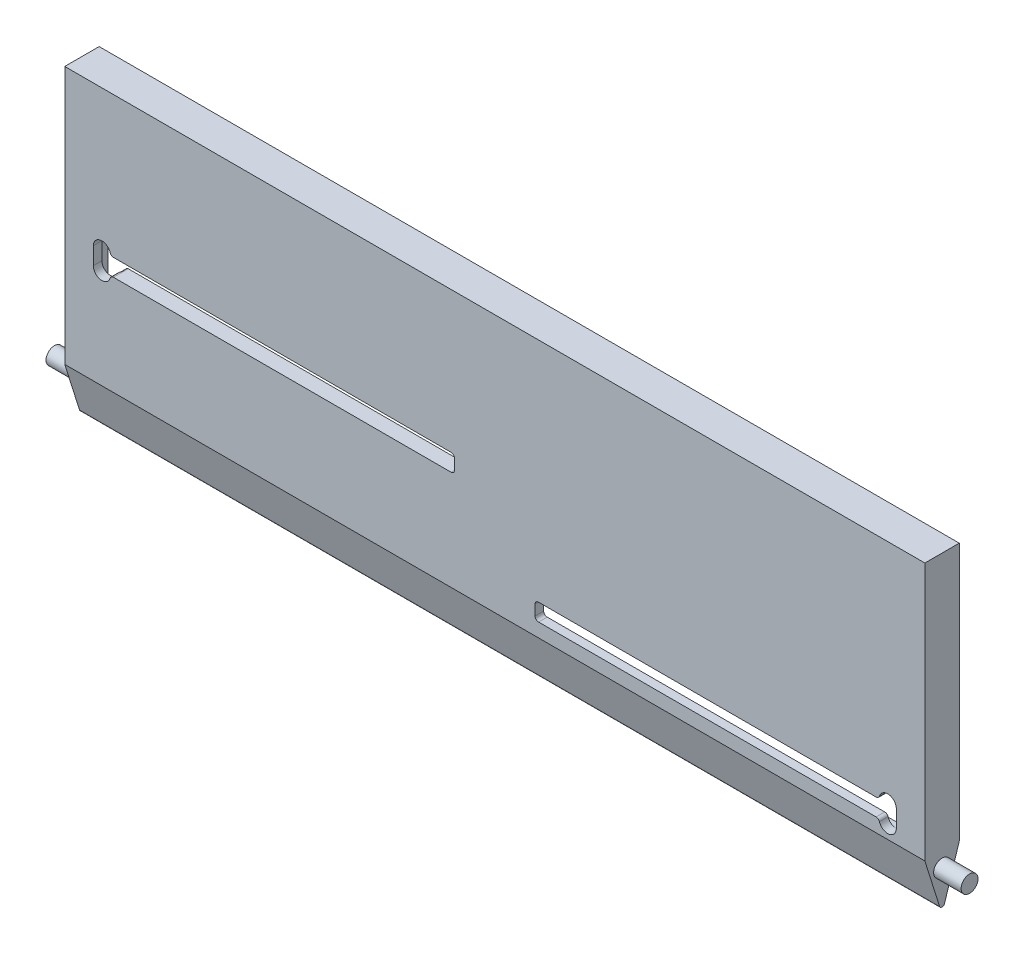
from build123d import *

# Parameters (mm, degrees)
BOSS_EXTRU_1_DEPTH           = 125
ESQUISSE2_R                  = 2.45
BOSS_EXTRU_2_DEPTH           = 8
CONG_1_R                     = 0.75
COQUE1_START                 = -122.5
COQUE1_DEPTH                 = 245
ENL_V_MAT_EXTRU_1_DEPTH      = 162.382066666
ESQUISSE4_R                  = 3.25
ESQUISSE4_R_2                = 1.65
BOSS_EXTRU_3_DEPTH           = 6
R_P_TITION_CIRCULAIRE1_COUNT = 2
BOSS_EXTRU_4_DEPTH           = 1.8


# Read off the part's stored shape, not the designer's step: Coque1
with BuildPart() as part:
    # Esquisse1 → Boss.-Extru.1 (new body)
    with BuildSketch(Plane(origin=(0, 0, 0), x_dir=(0, 0, -1), z_dir=(1, 0, 0))):
        Polygon((5, 15.857974012), (0, 0), (-5, 15.857974012), (-5, 90.857974012), (5, 90.857974012), align=None)
    boss_extru_1 = extrude(amount=BOSS_EXTRU_1_DEPTH)

    # Esquisse2 → Boss.-Extru.2 (add)
    with BuildSketch(Plane.ZY.offset(-125)):
        with Locations((0, 11.639283332)):
            Circle(ESQUISSE2_R)
    boss_extru_2 = extrude(amount=-BOSS_EXTRU_2_DEPTH)

    # Symétrie1: Boss.-Extru.1, Boss.-Extru.2 across plane
    add(boss_extru_1.mirror(Plane(origin=(0, 0, 0), x_dir=(0, 0, 1), z_dir=(1, 0, 0))))
    add(boss_extru_2.mirror(Plane(origin=(0, 0, 0), x_dir=(0, 0, 1), z_dir=(1, 0, 0))))

    # Congé1
    cong_1_edges = [part.edges().sort_by_distance(p)[0] for p in [
        (0, 0, 0),
    ]]
    fillet(cong_1_edges, radius=CONG_1_R)

    # Coque1 outline → Coque1 (cut)
    with BuildSketch(Plane.YZ.offset(COQUE1_START)):
        Polygon((16.242760814, 2.5), (4.156886904, -1.310661406), (15.857974012, -5), (88.357974012, -5), (88.357974012, 2.5), align=None)
    extrude(amount=COQUE1_DEPTH, mode=Mode.SUBTRACT)

    # Esquisse3 → Enlèv. mat.-Extru.1 (cut, through all)
    with BuildSketch(Plane.XY.offset(5)):
        with BuildLine():
            Line((116.7, 19.857974012), (116.7, 24.857974012))
            ThreePointArc((116.7, 24.857974012), (114.560923955, 27.331783604), (111.804212881, 25.572259726))
            ThreePointArc((111.804212881, 25.572259726), (111.443512338, 25.056190286), (110.845898034, 24.857974012))
            Line((110.845898034, 24.857974012), (12.7, 24.857974012))
            ThreePointArc((12.7, 24.857974012), (11.992893219, 24.565080793), (11.7, 23.857974012))
            Line((11.7, 23.857974012), (11.7, 20.857974012))
            ThreePointArc((11.7, 20.857974012), (11.992893219, 20.150867231), (12.7, 19.857974012))
            Line((12.7, 19.857974012), (110.845898034, 19.857974012))
            ThreePointArc((110.845898034, 19.857974012), (111.443512338, 19.659757738), (111.804212881, 19.143688298))
            ThreePointArc((111.804212881, 19.143688298), (114.560923955, 17.38416442), (116.7, 19.857974012))
        make_face()
    enl_v_mat_extru_1 = extrude(amount=-ENL_V_MAT_EXTRU_1_DEPTH, mode=Mode.SUBTRACT)

    # Esquisse4 → Boss.-Extru.3 (add)
    with BuildSketch(Plane(origin=(0, 0, 2.5), x_dir=(-1, 0, 0), z_dir=(0, 0, -1))):
        with Locations(Location((0, 34.857974012, 0), (0, 0, 90))):
            Circle(ESQUISSE4_R)
        with Locations(Location((0, 34.857974012, 0), (0, 0, 90))):
            Circle(ESQUISSE4_R_2, mode=Mode.SUBTRACT)
    extrude(amount=BOSS_EXTRU_3_DEPTH)

    # Répétition circulaire1: Enlèv. mat.-Extru.1 ×2 about axis
    r_p_tition_circulaire1_axis = Axis((0, 34.857974012, 0), (0, 0, 1))
    for i in range(1, R_P_TITION_CIRCULAIRE1_COUNT):
        add(enl_v_mat_extru_1.rotate(r_p_tition_circulaire1_axis, i * 360 / R_P_TITION_CIRCULAIRE1_COUNT), mode=Mode.SUBTRACT)

    # Esquisse5 → Boss.-Extru.4 (add)
    with BuildSketch(Plane(origin=(0, 0, 2.5), x_dir=(-1, 0, 0), z_dir=(0, 0, -1))):
        with BuildLine():
            Line((-13.95, 39.857974012), (-13.95, 29.857974012))
            ThreePointArc((-13.95, 29.857974012), (-13.25, 29.157974012), (-12.55, 29.857974012))
            Line((-12.55, 29.857974012), (-12.55, 39.857974012))
            ThreePointArc((-12.55, 39.857974012), (-13.25, 40.557974012), (-13.95, 39.857974012))
        make_face()
        with BuildLine():
            Line((12.55, 39.857974012), (12.55, 29.857974012))
            ThreePointArc((12.55, 29.857974012), (13.25, 29.157974012), (13.95, 29.857974012))
            Line((13.95, 29.857974012), (13.95, 39.857974012))
            ThreePointArc((13.95, 39.857974012), (13.25, 40.557974012), (12.55, 39.857974012))
        make_face()
        with BuildLine():
            Line((-12.7, 26.257974012), (122.5, 26.257974012))
            ThreePointArc((122.5, 26.257974012), (123.2, 25.557974012), (122.5, 24.857974012))
            Line((122.5, 24.857974012), (-12.7, 24.857974012))
            Line((-12.7, 24.857974012), (-110.845898034, 24.857974012))
            ThreePointArc((-110.845898034, 24.857974012), (-111.545898034, 25.557974012), (-110.845898034, 26.257974012))
            Line((-110.845898034, 26.257974012), (-12.7, 26.257974012))
        make_face()
        with BuildLine():
            Line((-122.5, 15.857974012), (122.5, 15.857974012))
            ThreePointArc((122.5, 15.857974012), (123.2, 16.557974012), (122.5, 17.257974012))
            Line((122.5, 17.257974012), (-122.5, 17.257974012))
            ThreePointArc((-122.5, 17.257974012), (-123.2, 16.557974012), (-122.5, 15.857974012))
        make_face()
        with BuildLine():
            Line((12.7, 43.457974012), (-122.5, 43.457974012))
            ThreePointArc((-122.5, 43.457974012), (-123.2, 44.157974012), (-122.5, 44.857974012))
            Line((-122.5, 44.857974012), (12.7, 44.857974012))
            Line((12.7, 44.857974012), (110.845898034, 44.857974012))
            ThreePointArc((110.845898034, 44.857974012), (111.545898034, 44.157974012), (110.845898034, 43.457974012))
            Line((110.845898034, 43.457974012), (12.7, 43.457974012))
        make_face()
        with BuildLine():
            Line((-122.5, 52.457974012), (122.5, 52.457974012))
            ThreePointArc((122.5, 52.457974012), (123.2, 53.157974012), (122.5, 53.857974012))
            Line((122.5, 53.857974012), (-122.5, 53.857974012))
            ThreePointArc((-122.5, 53.857974012), (-123.2, 53.157974012), (-122.5, 52.457974012))
        make_face()
    extrude(amount=BOSS_EXTRU_4_DEPTH)


solid = part.part
